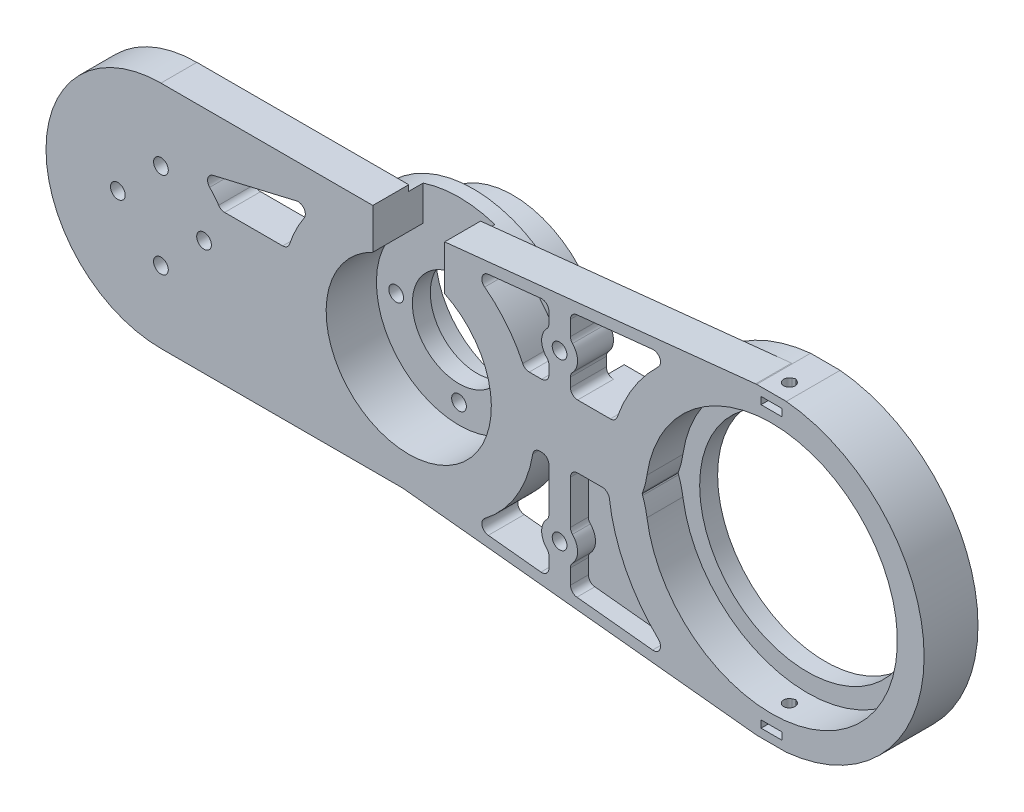
from build123d import *

# Parameters (mm, degrees)
MOTOR1_START            = -19
MOTOR_R                 = 25
MOTOR_R_2               = 13
MOTOR_R_3               = 2.05
MOTOR1_DEPTH            = 5
MOTOR2_START            = -34
MOTOR_4_R               = 25
MOTOR2_DEPTH            = 10
MOTOR3_START            = -23
MOTOR_5_R               = 32
MOTOR_5_R_2             = 25
MOTOR_5_R_3             = 23
MOTOR3_DEPTH            = 18
MAIN1_START             = -10
MAIN_R                  = 32
MAIN_R_2                = 16.25
MAIN1_DEPTH             = 10
MAIN2_START             = -7.5
MAIN_3_R                = 16.25
MAIN_3_R_2              = 2.05
MAIN2_DEPTH             = 7.5
MAIN3_START             = -15
MAIN_4_R                = 35.05
MAIN_4_R_2              = 30
MAIN3_DEPTH             = 5
LIMITSWITCH1_START      = 5
LIMITSWITCH_R           = 2.05
LIMITSWITCH1_DEPTH      = 5
SKETCH6_6_R             = 2.05
LIMITSWITCH2_DEPTH      = 2
FILLET1_R               = 25
TENSIONING_R            = 1.6
TENSTIONING1_DEPTH      = 10
TENSIONING_4_R          = 2.05
TENSIONING_4_R_2        = 1.6
TENSIONING2_DEPTH       = 7
SCREWACCESS_W           = 20
SCREWACCESS_H           = 15
SREWACCESS1_DEPTH       = 14
BEARINGPLIER1_START     = -15
BEARINGPLIER1_DEPTH     = 15
SKETCH9_3_W             = 5.8
SKETCH9_3_H             = 2
BEARINGPLIER2_DEPTH     = 7.9
BEARINGPLIERHOLE1_DEPTH = 84.9
CUT_EXTRUDE8_DEPTH      = 10
CUT_EXTRUDE10_DEPTH     = 5


with BuildPart() as part:
    # Motor → Motor1 (new body)
    with BuildSketch(Plane(origin=(0, 0, 0), x_dir=(0, 1, 0), z_dir=(0, 0, 1)).offset(MOTOR1_START)):
        with Locations(Location((0, 0, 0), (0, 0, 270))):
            Circle(MOTOR_R)
        with Locations(Location((0, 0, 0), (0, 0, 270))):
            Circle(MOTOR_R_2, mode=Mode.SUBTRACT)
        with Locations(Location((0, 17.5, 0), (0, 0, 270))):
            Circle(MOTOR_R_3, mode=Mode.SUBTRACT)
        with Locations(Location((17.5, 0, 0), (0, 0, 270))):
            Circle(MOTOR_R_3, mode=Mode.SUBTRACT)
        with Locations(Location((0, -17.5, 0), (0, 0, 270))):
            Circle(MOTOR_R_3, mode=Mode.SUBTRACT)
        with Locations(Location((-17.5, 0, 0), (0, 0, 270))):
            Circle(MOTOR_R_3, mode=Mode.SUBTRACT)
    extrude(amount=-MOTOR1_DEPTH)

    # Motor<4> → Motor2 (add)
    with BuildSketch(Plane(origin=(0, 0, 0), x_dir=(0, 1, 0), z_dir=(0, 0, 1)).offset(MOTOR2_START)):
        with Locations(Location((0, 0, 0), (0, 0, 270))):
            Circle(MOTOR_4_R)
        with BuildLine():
            ThreePointArc((1.590740706, 21.441071429), (15.202795796, 15.202795796), (21.441071429, 1.590740706))
            ThreePointArc((21.441071429, 1.590740706), (21.75, 0), (21.441071429, -1.590740706))
            ThreePointArc((21.441071429, -1.590740706), (15.202795796, -15.202795796), (1.590740706, -21.441071429))
            ThreePointArc((1.590740706, -21.441071429), (0, -21.75), (-1.590740706, -21.441071429))
            ThreePointArc((-1.590740706, -21.441071429), (-15.202795796, -15.202795796), (-21.441071429, -1.590740706))
            ThreePointArc((-21.441071429, -1.590740706), (-21.75, 0), (-21.441071429, 1.590740706))
            ThreePointArc((-21.441071429, 1.590740706), (-15.202795796, 15.202795796), (-1.590740706, 21.441071429))
            ThreePointArc((-1.590740706, 21.441071429), (0, 21.75), (1.590740706, 21.441071429))
        make_face(mode=Mode.SUBTRACT)
    extrude(amount=MOTOR2_DEPTH)

    # Motor<5> → Motor3 (add)
    # profile 1 of 2: a face of its own
    with BuildSketch(Plane(origin=(0, 0, 0), x_dir=(0, 1, 0), z_dir=(0, 0, 1)).offset(MOTOR3_START)):
        with Locations(Location((0, 0, 0), (0, 0, 270))):
            Circle(MOTOR_5_R)
        with Locations(Location((0, 0, 0), (0, 0, 270))):
            Circle(MOTOR_5_R_2, mode=Mode.SUBTRACT)
    # profile 2 of 2: a face of its own
    with BuildSketch(Plane(origin=(0, 0, 0), x_dir=(0, 1, 0), z_dir=(0, 0, 1)).offset(MOTOR3_START)):
        with Locations(Location((0, 0, 0), (0, 0, 270))):
            Circle(MOTOR_5_R_2)
        with Locations(Location((0, 0, 0), (0, 0, 270))):
            Circle(MOTOR_5_R_3, mode=Mode.SUBTRACT)
    extrude(amount=MOTOR3_DEPTH)

    # Main → Main1 (add)
    # profile 1 of 4: a face of its own
    with BuildSketch(Plane.XY.offset(-5).offset(MAIN1_START)):
        with Locations((-69, 0)):
            Circle(MAIN_R)
        with Locations((-69, 0)):
            Circle(MAIN_R_2, mode=Mode.SUBTRACT)
    # profile 2 of 4: a face of its own
    with BuildSketch(Plane.XY.offset(-5).offset(MAIN1_START)):
        with BuildLine():
            Line((-1.667885106, 32), (-69, 32))
            ThreePointArc((-69, 32), (-46.372583002, 22.627416998), (-37, 0))
            ThreePointArc((-37, 0), (-46.372583002, -22.627416998), (-69, -32))
            Line((-69, -32), (-1.667885106, -32))
            Line((-1.667885106, -32), (-3.326732673, -31.826606004))
            ThreePointArc((-3.326732673, -31.826606004), (-32, 0), (-3.326732673, 31.826606004))
            Line((-3.326732673, 31.826606004), (-1.667885106, 32))
        make_face()
    # profile 3 of 4: a face of its own
    with BuildSketch(Plane.XY.offset(-5).offset(MAIN1_START)):
        with BuildLine():
            Line((96.581683168, 42.269711099), (-1.667885106, 32))
            Line((-1.667885106, 32), (-3.326732673, 31.826606004))
            ThreePointArc((-3.326732673, 31.826606004), (21.418970032, 23.77451835), (32, 0))
            ThreePointArc((32, 0), (21.418970032, -23.77451835), (-3.326732673, -31.826606004))
            Line((-3.326732673, -31.826606004), (-1.667885106, -32))
            Line((-1.667885106, -32), (96.581683168, -42.269711099))
            ThreePointArc((96.581683168, -42.269711099), (58.5, 0), (96.581683168, 42.269711099))
        make_face()
    # profile 4 of 4: a face of its own
    with BuildSketch(Plane.XY.offset(-5).offset(MAIN1_START)):
        with BuildLine():
            ThreePointArc((143.5, 0), (129.447069574, 31.575532184), (96.581683168, 42.269711099))
            ThreePointArc((96.581683168, 42.269711099), (58.5, 0), (96.581683168, -42.269711099))
            ThreePointArc((96.581683168, -42.269711099), (129.447069574, -31.575532184), (143.5, 0))
        make_face()
        with BuildLine():
            Line((66.0796875, -3.012353715), (65, 0))
            Line((65, 0), (66.0796875, 3.012353715))
            ThreePointArc((66.0796875, 3.012353715), (102.507572034, 35.017563116), (136.05, 0))
            ThreePointArc((136.05, 0), (102.507572034, -35.017563116), (66.0796875, -3.012353715))
        make_face(mode=Mode.SUBTRACT)
    extrude(amount=MAIN1_DEPTH)

    # Main<3> → Main2 (add)
    with BuildSketch(Plane.XY.offset(-5).offset(MAIN2_START)):
        with Locations((-69, 0)):
            Circle(MAIN_3_R)
        with Locations((-57, 0)):
            Circle(MAIN_3_R_2, mode=Mode.SUBTRACT)
        with Locations((-69, 12)):
            Circle(MAIN_3_R_2, mode=Mode.SUBTRACT)
        with Locations((-81, 0)):
            Circle(MAIN_3_R_2, mode=Mode.SUBTRACT)
        with Locations((-69, -12)):
            Circle(MAIN_3_R_2, mode=Mode.SUBTRACT)
    extrude(amount=MAIN2_DEPTH)

    # Main<4> → Main3 (add)
    # profile 1 of 3: a face of its own
    with BuildSketch(Plane.XY.offset(-5).offset(MAIN3_START)):
        with BuildLine():
            ThreePointArc((143.5, 0), (129.447069574, 31.575532184), (96.581683168, 42.269711099))
            ThreePointArc((96.581683168, 42.269711099), (58.5, 0), (96.581683168, -42.269711099))
            ThreePointArc((96.581683168, -42.269711099), (129.447069574, -31.575532184), (143.5, 0))
        make_face()
        with BuildLine():
            Line((66.0796875, -3.012353715), (65, 0))
            Line((65, 0), (66.0796875, 3.012353715))
            ThreePointArc((66.0796875, 3.012353715), (102.507572034, 35.017563116), (136.05, 0))
            ThreePointArc((136.05, 0), (102.507572034, -35.017563116), (66.0796875, -3.012353715))
        make_face(mode=Mode.SUBTRACT)
    # profile 2 of 3: a face of its own
    with BuildSketch(Plane.XY.offset(-5).offset(MAIN3_START)):
        with Locations((101, 0)):
            Circle(MAIN_4_R)
        with Locations((101, 0)):
            Circle(MAIN_4_R_2, mode=Mode.SUBTRACT)
    # profile 3 of 3: a face of its own
    with BuildSketch(Plane.XY.offset(-5).offset(MAIN3_START)):
        with BuildLine():
            Line((66.0796875, 3.012353715), (65, 0))
            Line((65, 0), (66.0796875, -3.012353715))
            ThreePointArc((66.0796875, -3.012353715), (65.95, 0), (66.0796875, 3.012353715))
        make_face()
    extrude(amount=MAIN3_DEPTH)

    # LimitSwitch → LimitSwitch1 (add)
    # profile 1 of 3: a face of its own
    with BuildSketch(Plane(origin=(0, 0, -15), x_dir=(1, 0, 0), z_dir=(0, 0, -1)).offset(LIMITSWITCH1_START)):
        with BuildLine():
            Line((45, 30.6), (45, 28.6))
            Line((45, 28.6), (69.562919983, 28.6))
            ThreePointArc((69.562919983, 28.6), (70.51810356, 29.615941474), (71.506102326, 30.6))
            Line((71.506102326, 30.6), (45, 30.6))
        make_face()
    # profile 2 of 3: a face of its own
    with BuildSketch(Plane(origin=(0, 0, -15), x_dir=(1, 0, 0), z_dir=(0, 0, -1)).offset(LIMITSWITCH1_START)):
        with BuildLine():
            Line((45, 28.6), (45, 0))
            Line((45, 0), (45, -11.6))
            Line((45, -11.6), (60.113694224, -11.6))
            ThreePointArc((60.113694224, -11.6), (59.627569166, 9.724811919), (69.562919983, 28.6))
            Line((69.562919983, 28.6), (45, 28.6))
        make_face()
        with Locations(Location((56, -7.5, 0), (0, 0, 180))):
            Circle(LIMITSWITCH_R, mode=Mode.SUBTRACT)
        with Locations(Location((56, 24.5, 0), (0, 0, 180))):
            Circle(LIMITSWITCH_R, mode=Mode.SUBTRACT)
    # profile 3 of 3: a face of its own
    with BuildSketch(Plane(origin=(0, 0, -15), x_dir=(1, 0, 0), z_dir=(0, 0, -1)).offset(LIMITSWITCH1_START)):
        with BuildLine():
            Line((60.113694224, -11.6), (45, -11.6))
            Line((45, -11.6), (45, -13.6))
            Line((45, -13.6), (60.73475444, -13.6))
            ThreePointArc((60.73475444, -13.6), (60.411903579, -12.603825965), (60.113694224, -11.6))
        make_face()
    extrude(amount=-LIMITSWITCH1_DEPTH)

    # Sketch6<6> → LimitSwitch2 (cut)
    with BuildSketch(Plane(origin=(0, 0, -15), x_dir=(1, 0, 0), z_dir=(0, 0, -1))):
        with Locations(Location((56, -7.5, 0), (0, 0, 180))):
            Circle(SKETCH6_6_R)
        with Locations(Location((56, 24.5, 0), (0, 0, 180))):
            Circle(SKETCH6_6_R)
    extrude(amount=-LIMITSWITCH2_DEPTH, mode=Mode.SUBTRACT)

    # Fillet1
    fillet1_edges = [part.edges().sort_by_distance(p)[0] for p in [
        (66.0796875, -3.012353715, -10),
        (66.0796875, 3.012353715, -10),
    ]]
    fillet(fillet1_edges, radius=FILLET1_R)

    # Tensioning → Tenstioning1 (cut)
    with BuildSketch(Plane.XY.offset(-5)):
        with Locations((42, 23)):
            Circle(TENSIONING_R)
        with Locations((42, -23)):
            Circle(TENSIONING_R)
    extrude(amount=-TENSTIONING1_DEPTH, mode=Mode.SUBTRACT)

    # Tensioning<4> → Tensioning2 (cut)
    # profile 1 of 2: a face of its own
    with BuildSketch(Plane.XY.offset(-5)):
        with Locations((42, 23)):
            Circle(TENSIONING_4_R)
        with Locations((42, 23)):
            Circle(TENSIONING_4_R_2, mode=Mode.SUBTRACT)
    # profile 2 of 2: a face of its own
    with BuildSketch(Plane.XY.offset(-5)):
        with Locations((42, -23)):
            Circle(TENSIONING_4_R)
        with Locations((42, -23)):
            Circle(TENSIONING_4_R_2, mode=Mode.SUBTRACT)
    extrude(amount=-TENSIONING2_DEPTH, mode=Mode.SUBTRACT)

    # ScrewAccess → SrewAccess1 (cut)
    with BuildSketch(Plane.XY.offset(-5)):
        with Locations((0, 27.5)):
            Rectangle(SCREWACCESS_W, SCREWACCESS_H)
    extrude(amount=-SREWACCESS1_DEPTH, mode=Mode.SUBTRACT)

    # BearingPlier → BearingPlier1 (cut)
    with BuildSketch(Plane.XY.offset(-5).offset(BEARINGPLIER1_START)):
        with BuildLine():
            Line((96.881747944, 42.3), (105.118252056, 42.3))
            ThreePointArc((105.118252056, 42.3), (101, 42.5), (96.881747944, 42.3))
        make_face()
        with BuildLine():
            ThreePointArc((96.881747944, -42.3), (101, -42.5), (105.118252056, -42.3))
            Line((105.118252056, -42.3), (96.881747944, -42.3))
        make_face()
    extrude(amount=BEARINGPLIER1_DEPTH, mode=Mode.SUBTRACT)

    # Sketch9<3> → BearingPlier2 (cut)
    with BuildSketch(Plane.XY.offset(-5)):
        with Locations((101, -39)):
            Rectangle(SKETCH9_3_W, SKETCH9_3_H)
        with Locations((101, 39)):
            Rectangle(SKETCH9_3_W, SKETCH9_3_H)
    extrude(amount=-BEARINGPLIER2_DEPTH, mode=Mode.SUBTRACT)

    # BearingPlierHole → BearingPlierHole1 (cut)
    with BuildSketch(Plane.XZ.offset(42.3)):
        with BuildLine():
            Line((100.267003444, -11.409370341), (101, -11.787148119))
            Line((101, -11.787148119), (101.732996556, -11.409370341))
            ThreePointArc((101.732996556, -11.409370341), (101, -8.387148119), (100.267003444, -11.409370341))
        make_face()
    extrude(amount=-BEARINGPLIERHOLE1_DEPTH, mode=Mode.SUBTRACT)

    # Sketch12 → Cut-Extrude8 (cut)
    with BuildSketch(Plane.XY.offset(-5)):
        with BuildLine():
            Line((56.134757328, 13.6), (47.020896607, 13.6))
            ThreePointArc((47.020896607, 13.6), (45.606683045, 14.185786438), (45.020896607, 15.6))
            Line((45.020896607, 15.6), (45.020896607, 18.122439415))
            ThreePointArc((45.020896607, 18.122439415), (45.167644901, 18.874408904), (45.58635472, 19.516028154))
            ThreePointArc((45.58635472, 19.516028154), (47, 23), (45.58635472, 26.483971846))
            ThreePointArc((45.58635472, 26.483971846), (45.167644901, 27.125591096), (45.020896607, 27.877560585))
            Line((45.020896607, 27.877560585), (45.020896607, 32.062041204))
            ThreePointArc((45.020896607, 32.062041204), (45.534989211, 33.400726831), (46.812975815, 34.051204079))
            Line((46.812975815, 34.051204079), (67.896781765, 36.255026445))
            ThreePointArc((67.896781765, 36.255026445), (69.918803857, 35.107906606), (69.489767713, 32.823090366))
            ThreePointArc((69.489767713, 32.823090366), (62.698833, 24.561567671), (58.023820178, 14.943157895))
            ThreePointArc((58.023820178, 14.943157895), (57.293704219, 13.970017759), (56.134757328, 13.6))
        make_face()
        with BuildLine():
            Line((-54.47263277, 17.015231452), (-31.249913657, 22.459806242))
            ThreePointArc((-31.249913657, 22.459806242), (-29.150353415, 21.652967781), (-29.128884247, 19.4038167))
            ThreePointArc((-29.128884247, 19.4038167), (-31.446274479, 15.366581317), (-33.207397648, 11.057519678))
            ThreePointArc((-33.207397648, 11.057519678), (-33.935287319, 10.067077644), (-35.104963228, 9.689377946))
            Line((-35.104963228, 9.689377946), (-51.253987962, 9.689377946))
            ThreePointArc((-51.253987962, 9.689377946), (-52.202578101, 9.928646067), (-52.92420086, 10.589201198))
            ThreePointArc((-52.92420086, 10.589201198), (-54.096502659, 12.183934791), (-55.426359404, 13.649863772))
            ThreePointArc((-55.426359404, 13.649863772), (-55.940333619, 15.613345502), (-54.47263277, 17.015231452))
        make_face()
        with BuildLine():
            Line((22.146289806, -31.472874794), (36.812975815, -33.00593627))
            ThreePointArc((36.812975815, -33.00593627), (38.359582234, -32.502680791), (39.020896607, -31.016773395))
            Line((39.020896607, -31.016773395), (39.020896607, -27.920216398))
            ThreePointArc((39.020896607, -27.920216398), (38.870923896, -27.160348626), (38.443497577, -26.514440284))
            ThreePointArc((38.443497577, -26.514440284), (37, -23), (38.443497577, -19.485559716))
            ThreePointArc((38.443497577, -19.485559716), (38.870923896, -18.839651374), (39.020896607, -18.079783602))
            Line((39.020896607, -18.079783602), (39.020896607, -6))
            ThreePointArc((39.020896607, -6), (38.43511017, -4.585786438), (37.020896607, -4))
            Line((37.020896607, -4), (36.510272527, -4))
            ThreePointArc((36.510272527, -4), (35.215793607, -4.475426511), (34.536744282, -5.675675676))
            ThreePointArc((34.536744282, -5.675675676), (29.975115444, -18.069102194), (21.14587489, -27.889997761))
            ThreePointArc((21.14587489, -27.889997761), (20.427893496, -30.021580326), (22.146289806, -31.472874794))
        make_face()
        with BuildLine():
            Line((22.146289806, 31.472874794), (36.812975815, 33.00593627))
            ThreePointArc((36.812975815, 33.00593627), (38.359582234, 32.502680791), (39.020896607, 31.016773395))
            Line((39.020896607, 31.016773395), (39.020896607, 27.920216398))
            ThreePointArc((39.020896607, 27.920216398), (38.870923896, 27.160348626), (38.443497577, 26.514440284))
            ThreePointArc((38.443497577, 26.514440284), (37, 23), (38.443497577, 19.485559716))
            ThreePointArc((38.443497577, 19.485559716), (38.870923896, 18.839651374), (39.020896607, 18.079783602))
            Line((39.020896607, 18.079783602), (39.020896607, 15.6))
            ThreePointArc((39.020896607, 15.6), (38.43511017, 14.185786438), (37.020896607, 13.6))
            Line((37.020896607, 13.6), (33.550558863, 13.6))
            ThreePointArc((33.550558863, 13.6), (32.475032593, 13.913808065), (31.73701514, 14.756756757))
            ThreePointArc((31.73701514, 14.756756757), (27.24464203, 21.971105586), (21.14587489, 27.889997761))
            ThreePointArc((21.14587489, 27.889997761), (20.427893496, 30.021580326), (22.146289806, 31.472874794))
        make_face()
    extrude(amount=-CUT_EXTRUDE8_DEPTH, mode=Mode.SUBTRACT)

    # Sketch12<5> → Cut-Extrude10 (cut)
    with BuildSketch(Plane.XY.offset(-5)):
        with BuildLine():
            Line((53.88047114, -4), (47.020896607, -4))
            ThreePointArc((47.020896607, -4), (45.606683045, -4.585786438), (45.020896607, -6))
            Line((45.020896607, -6), (45.020896607, -18.122439415))
            ThreePointArc((45.020896607, -18.122439415), (45.167644901, -18.874408904), (45.58635472, -19.516028154))
            ThreePointArc((45.58635472, -19.516028154), (47, -23), (45.58635472, -26.483971846))
            ThreePointArc((45.58635472, -26.483971846), (45.167644901, -27.125591096), (45.020896607, -27.877560585))
            Line((45.020896607, -27.877560585), (45.020896607, -32.062041204))
            ThreePointArc((45.020896607, -32.062041204), (45.534989211, -33.400726831), (46.812975815, -34.051204079))
            Line((46.812975815, -34.051204079), (67.896781765, -36.255026445))
            ThreePointArc((67.896781765, -36.255026445), (69.918803857, -35.107906606), (69.489767713, -32.823090366))
            ThreePointArc((69.489767713, -32.823090366), (60.356210617, -20.453175416), (55.864451302, -5.747368421))
            ThreePointArc((55.864451302, -5.747368421), (55.202351778, -4.499123063), (53.88047114, -4))
        make_face()
    extrude(amount=-CUT_EXTRUDE10_DEPTH, mode=Mode.SUBTRACT)


solid = part.part
